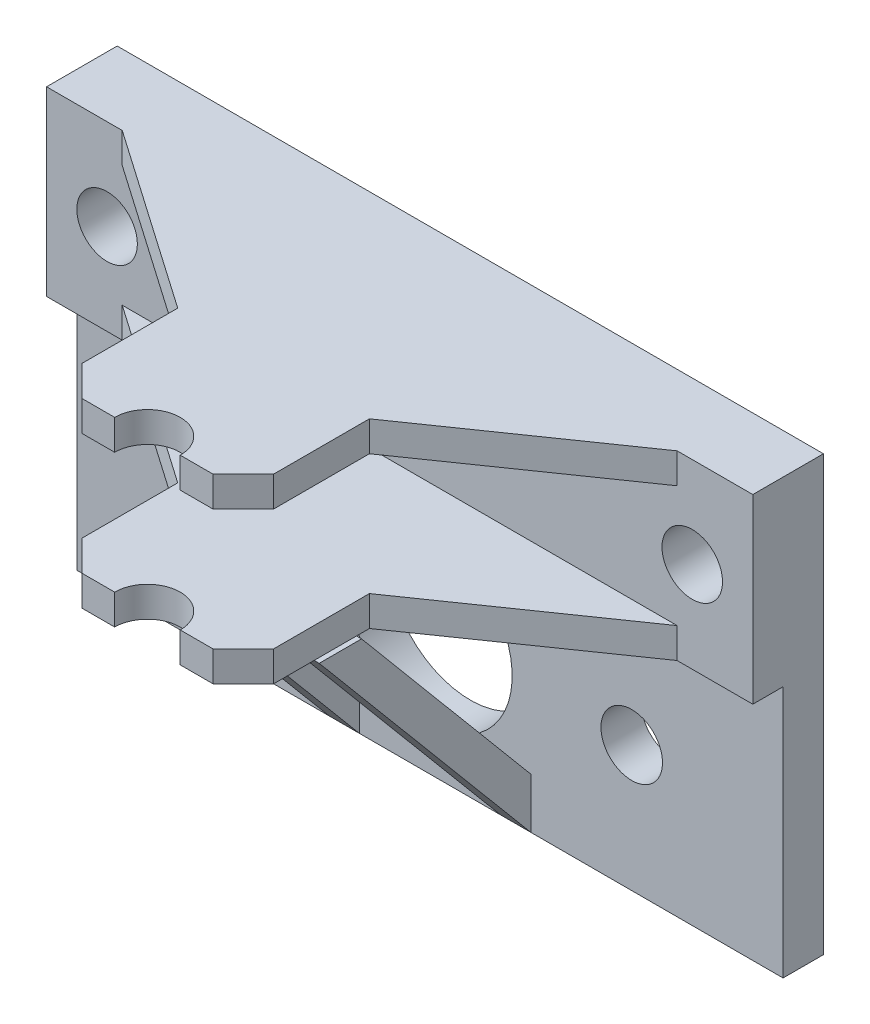
from build123d import *

# Parameters (mm, degrees)
BOSS_EXTRUDE1_DEPTH = 3
SKETCH2_W           = 70
SKETCH2_H           = 18
SKETCH2_R           = 3
BOSS_EXTRUDE2_DEPTH = 3
CHAMFER1_SIZE       = 3
SKETCH4_W           = 70
SKETCH4_H           = 43
SKETCH4_R           = 3
SKETCH4_R_2         = 8.15
SKETCH4_R_3         = 3.05
BOSS_EXTRUDE3_DEPTH = 4
BOSS_EXTRUDE4_DEPTH = 3


with BuildPart() as part:
    # Sketch1 → Boss-Extrude1 (new body)
    with BuildSketch(Plane(origin=(0, 0, 0), x_dir=(1, 0, 0), z_dir=(0, 1, 0))):
        with BuildLine():
            Line((0, 25), (55, 25))
            Line((55, 25), (37, 12.5))
            Line((37, 12.5), (37, 0))
            Line((37, 0), (30.75, 0))
            ThreePointArc((30.75, 0), (27.5, 3.25), (24.25, 0))
            Line((24.25, 0), (18, 0))
            Line((18, 0), (18, 12.5))
            Line((18, 12.5), (0, 25))
        make_face()
    boss_extrude1 = extrude(amount=BOSS_EXTRUDE1_DEPTH)

    # Sketch2 → Boss-Extrude2 (add)
    with BuildSketch(Plane(origin=(0, 0, -25), x_dir=(-1, 0, 0), z_dir=(0, 0, -1))):
        with Locations((-27.5, -6)):
            Rectangle(SKETCH2_W, SKETCH2_H)
        with Locations((-56.5, -6)):
            Circle(SKETCH2_R, mode=Mode.SUBTRACT)
        with Locations((1.5, -6)):
            Circle(SKETCH2_R, mode=Mode.SUBTRACT)
    extrude(amount=BOSS_EXTRUDE2_DEPTH)

    # Mirror1: Boss-Extrude1 across plane
    add(boss_extrude1.mirror(Plane.ZX.offset(-6)))

    # Chamfer1
    chamfer1_edges = [part.edges().sort_by_distance(p)[0] for p in [
        (37, 1.5, 0),
        (18, 1.5, 0),
        (37, -13.5, 0),
        (18, -13.5, 0),
    ]]
    chamfer(chamfer1_edges, length=CHAMFER1_SIZE)

    # Sketch4 → Boss-Extrude3 (add)
    with BuildSketch(Plane(origin=(0, 0, -28), x_dir=(-1, 0, 0), z_dir=(0, 0, -1))):
        with Locations((-27.5, -18.5)):
            Rectangle(SKETCH4_W, SKETCH4_H)
        with Locations((-56.5, -6)):
            Circle(SKETCH4_R, mode=Mode.SUBTRACT)
        with Locations((1.5, -6)):
            Circle(SKETCH4_R, mode=Mode.SUBTRACT)
        with Locations((-27.5, -27.5)):
            Circle(SKETCH4_R_2, mode=Mode.SUBTRACT)
        with Locations((-47.5, -27.5)):
            Circle(SKETCH4_R_3, mode=Mode.SUBTRACT)
        with Locations((-7.5, -27.5)):
            Circle(SKETCH4_R_3, mode=Mode.SUBTRACT)
    extrude(amount=BOSS_EXTRUDE3_DEPTH)

    # Sketch5 → Boss-Extrude4 (add)
    with BuildSketch(Plane(origin=(37.5, 0, 0), x_dir=(0, 0, -1), z_dir=(1, 0, 0))):
        Polygon((28, -40), (7.022509221, -15), (11.218007376, -15), (28, -35), align=None)
    boss_extrude4 = extrude(amount=-BOSS_EXTRUDE4_DEPTH)

    # Mirror2: Boss-Extrude4 across plane
    add(boss_extrude4.mirror(Plane(origin=(27.5, 0, 0), x_dir=(0, 0, 1), z_dir=(1, 0, 0))))


solid = part.part
